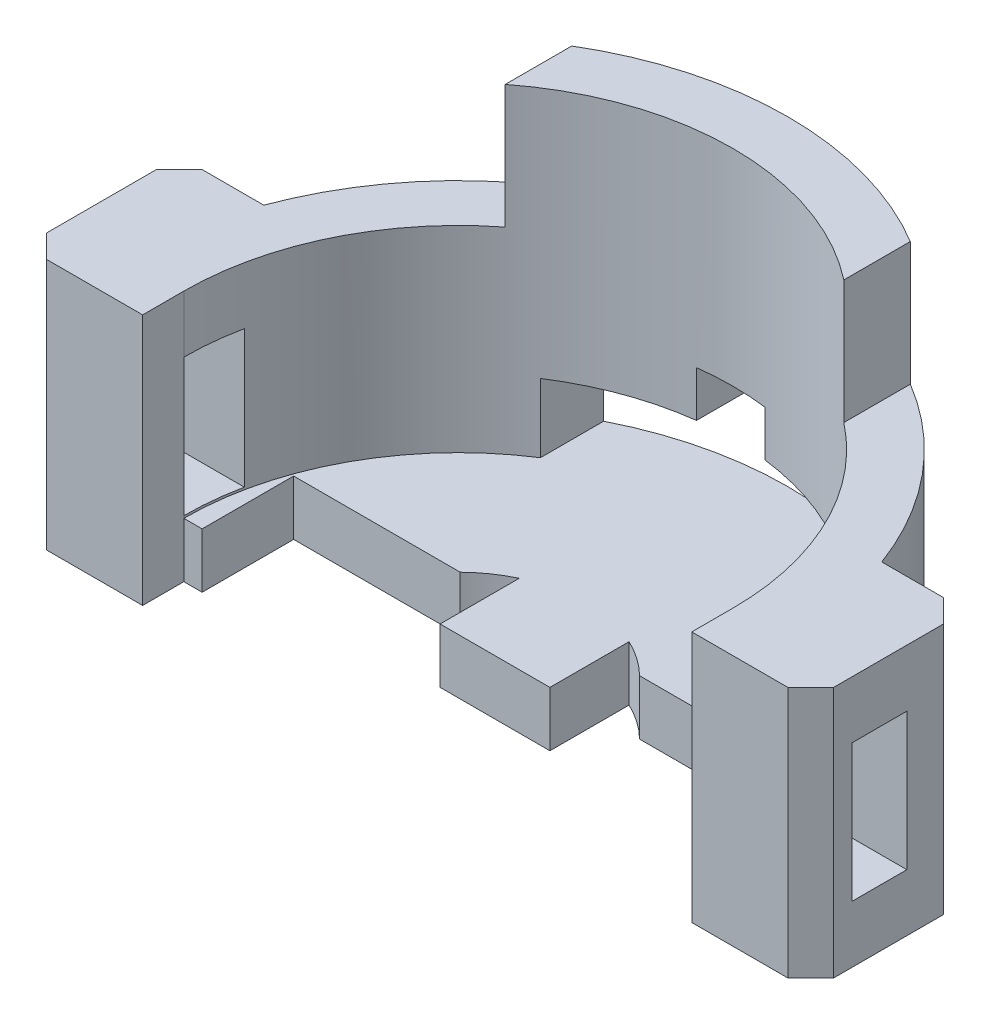
from build123d import *

# Parameters (mm, degrees)
SKETCH1_W                = 6
SKETCH1_H                = 1.2
SKETCH1_W_2              = 1.2
SKETCH1_H_2              = 4.3
REVOLVE1_ANGLE           = 180
REVOLVE2_START           = 4.3
REVOLVE2_DEPTH           = 2.7
CUT_EXTRUDE1_DEPTH       = 10
CUT_EXTRUDE2_DEPTH       = 10
SKETCH9_W                = 3.4
SKETCH9_H                = 5.5
SKETCH9_W_2              = 1.2
SKETCH9_H_2              = 3
BOSS_EXTRUDE5_DEPTH      = 2.6
SKETCH11_W               = 1.2
SKETCH11_H               = 3
CUT_EXTRUDE3_DEPTH       = 3.6
CHAMFER2_SIZE            = 0.5
CHAMFER3_SIZE            = 0.5
CHAMFER2_OF_MIRROR2_SIZE = 0.5
CHAMFER3_OF_MIRROR2_SIZE = 0.5
SKETCH5_W                = 4
SKETCH5_H                = 2
CUT_EXTRUDE4_DEPTH       = 3.6


# Read off the part's stored shape, not the designer's step: Revolve2
with BuildPart() as part:
    # Sketch1 → Revolve1 (revolve)
    with BuildSketch(Plane.XY):
        with Locations((3, -0.6)):
            Rectangle(SKETCH1_W, SKETCH1_H)
        with Locations((6.6, -0.6)):
            Rectangle(SKETCH1_W_2, SKETCH1_H)
        with Locations((6.6, 2.15)):
            Rectangle(SKETCH1_W_2, SKETCH1_H_2)
    revolve(axis=Axis((0, -1.2, 0), (0, 1, 0)), revolution_arc=REVOLVE1_ANGLE)

    # Revolve2 outline → Revolve2 (add)
    with BuildSketch(Plane(origin=(0, 0, 0), x_dir=(1, 0, 0), z_dir=(0, 1, 0)).offset(REVOLVE2_START)):
        with BuildLine():
            ThreePointArc((3.7, 6.176568627), (0, 7.2), (-3.7, 6.176568627))
            Line((-3.7, 6.176568627), (-3.7, 4.723346271))
            ThreePointArc((-3.7, 4.723346271), (0, 6), (3.7, 4.723346271))
            Line((3.7, 4.723346271), (3.7, 6.176568627))
        make_face()
    extrude(amount=REVOLVE2_DEPTH)

    # Sketch3 → Cut-Extrude1 (cut)
    with BuildSketch(Plane.XY):
        Polygon((-3.25, 1.5), (-0.75, 1.5), (-0.75, 2.5), (0.75, 2.5), (0.75, 1.5), (3.25, 1.5), (3.25, 0), (-3.25, 0), align=None)
    extrude(amount=-CUT_EXTRUDE1_DEPTH, mode=Mode.SUBTRACT)

    # Sketch4 → Cut-Extrude2 (cut)
    with BuildSketch(Plane(origin=(0, 0, 0), x_dir=(1, 0, 0), z_dir=(0, 1, 0))):
        with BuildLine():
            Line((-1.2, 0.8), (-1.2, 2.529822128))
            ThreePointArc((-1.2, 2.529822128), (-2.366431913, 1.496662955), (-2.8, 0))
            Line((-2.8, 0), (2.8, 0))
            ThreePointArc((2.8, 0), (2.366431913, 1.496662955), (1.2, 2.529822128))
            Line((1.2, 2.529822128), (1.2, 0.8))
            Line((1.2, 0.8), (-1.2, 0.8))
        make_face()
    extrude(amount=-CUT_EXTRUDE2_DEPTH, mode=Mode.SUBTRACT)

    # Sketch9 → Boss-Extrude5 (add)
    with BuildSketch(Plane(origin=(6, 0, 0), x_dir=(0, 0, -1), z_dir=(1, 0, 0))):
        with Locations((0.8, 1.55)):
            Rectangle(SKETCH9_W, SKETCH9_H)
        with Locations((0.6, 1.55)):
            Rectangle(SKETCH9_W_2, SKETCH9_H_2, mode=Mode.SUBTRACT)
    boss_extrude5 = extrude(amount=BOSS_EXTRUDE5_DEPTH)

    # Sketch11 → Cut-Extrude3 (cut)
    with BuildSketch(Plane(origin=(8.6, 0, 0), x_dir=(0, 0, -1), z_dir=(1, 0, 0))):
        with Locations((0.6, 1.55)):
            Rectangle(SKETCH11_W, SKETCH11_H)
    cut_extrude3 = extrude(amount=-CUT_EXTRUDE3_DEPTH, mode=Mode.SUBTRACT)

    # Chamfer2
    chamfer2_edges = [part.edges().sort_by_distance(p)[0] for p in [
        (8.6, 1.55, 0.9),
    ]]
    chamfer(chamfer2_edges, length=CHAMFER2_SIZE)

    # Chamfer3
    chamfer3_edges = [part.edges().sort_by_distance(p)[0] for p in [
        (8.6, 1.55, -2.5),
    ]]
    chamfer(chamfer3_edges, length=CHAMFER3_SIZE)

    # Mirror2: Boss-Extrude5, Cut-Extrude3 across plane
    add(boss_extrude5.mirror(Plane(origin=(0, 0, 0), x_dir=(0, 0, 1), z_dir=(1, 0, 0))))
    add(cut_extrude3.mirror(Plane(origin=(0, 0, 0), x_dir=(0, 0, 1), z_dir=(1, 0, 0))), mode=Mode.SUBTRACT)

    # Chamfer2 of Mirror2
    chamfer2_of_mirror2_edges = [part.edges().sort_by_distance(p)[0] for p in [
        (-8.6, 1.55, 0.9),
    ]]
    chamfer(chamfer2_of_mirror2_edges, length=CHAMFER2_OF_MIRROR2_SIZE)

    # Chamfer3 of Mirror2
    chamfer3_of_mirror2_edges = [part.edges().sort_by_distance(p)[0] for p in [
        (-8.6, 1.55, -2.5),
    ]]
    chamfer(chamfer3_of_mirror2_edges, length=CHAMFER3_OF_MIRROR2_SIZE)

    # Sketch5 → Cut-Extrude4 (cut)
    with BuildSketch(Plane(origin=(0, 0, 0), x_dir=(1, 0, 0), z_dir=(0, 1, 0))):
        with Locations((-3.6, 1)):
            Rectangle(SKETCH5_W, SKETCH5_H)
        with Locations((3.6, 1)):
            Rectangle(SKETCH5_W, SKETCH5_H)
    extrude(amount=-CUT_EXTRUDE4_DEPTH, mode=Mode.SUBTRACT)


solid = part.part
